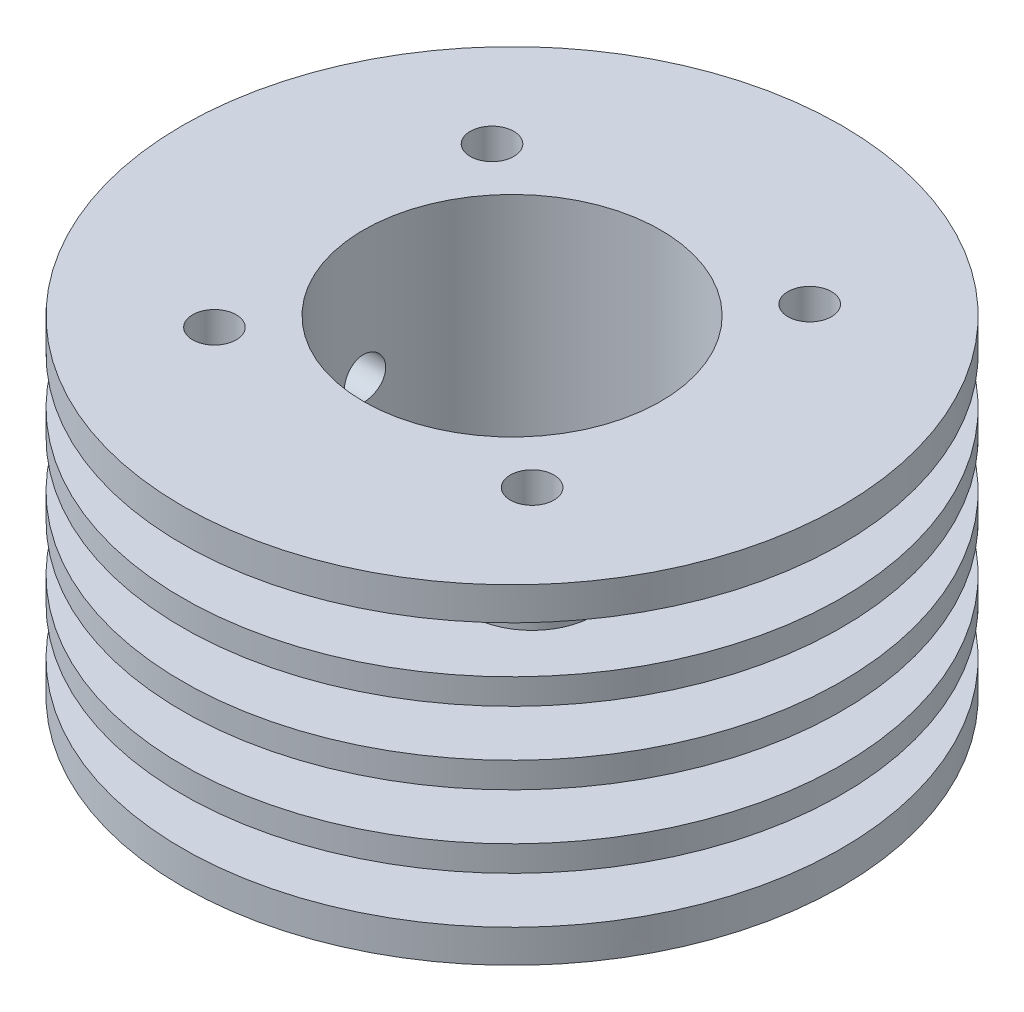
from build123d import *

# Parameters (mm, degrees)
SKETCH1_R                        = 31.75
SKETCH1_R_2                      = 14.3129
BOSS_EXTRUDE1_DEPTH              = 31.75
SKETCH2_W                        = 13.97
SKETCH2_H                        = 4.5
BOSS_EXTRUDE2_START              = -7.675
BOSS_EXTRUDE2_DEPTH              = 4.5
CUT_EXTRUDE2_REACH               = 56.993
CUT_EXTRUDE2_END_RADIUS          = 17.78
SKETCH8_R                        = 2
CUT_EXTRUDE3_REACH               = 56.993
CUT_EXTRUDE3_END_RADIUS          = 17.78
SKETCH9_R                        = 2
SKETCH10_R                       = 1
CUT_EXTRUDE4_DEPTH               = 10.141666667
TAP_DRILL_FOR_M5X0_8_TAP1_REACH  = 74.51
TAP_DRILL_FOR_M5X0_8_TAP1_BORE_R = 2.1


# Read off the part's stored shape, not the designer's step: Boss-Extrude2
with BuildPart() as part:
    # Sketch1 → Boss-Extrude1 (new body)
    with BuildSketch(Plane(origin=(0, 0, 0), x_dir=(1, 0, 0), z_dir=(0, 1, 0))):
        with Locations(Location((0, 0, 0), (0, 0, 270))):
            Circle(SKETCH1_R)
        with Locations(Location((0, 0, 0), (0, 0, 270))):
            Circle(SKETCH1_R_2, mode=Mode.SUBTRACT)
    extrude(amount=BOSS_EXTRUDE1_DEPTH)

    # Sketch2 → Cut-Revolve2 (revolve, cut)
    with BuildSketch(Plane.XY, mode=Mode.PRIVATE) as cut_revolve2_sk:
        with Locations((24.765, 26.325)):
            Rectangle(SKETCH2_W, SKETCH2_H)
        with Locations((24.765, 12.391666667)):
            Rectangle(SKETCH2_W, SKETCH2_H)
        with Locations((24.765, 5.425)):
            Rectangle(SKETCH2_W, SKETCH2_H)
        with Locations((24.765, 19.358333333)):
            Rectangle(SKETCH2_W, SKETCH2_H)
    revolve(cut_revolve2_sk.sketch.rotate(Axis((0, 0, 0), (0, 1, 0)), 90), axis=Axis((0, 0, 0), (0, 1, 0)), mode=Mode.SUBTRACT)

    # Boss-Extrude2 outline → Boss-Extrude2 (add)
    with BuildSketch(Plane(origin=(0, 31.75, 0), x_dir=(1, 0, 0), z_dir=(0, 1, 0)).offset(BOSS_EXTRUDE2_START)):
        with BuildLine():
            ThreePointArc((-10.269067687, -20.446529483), (-6.799835435, -18.70202978), (-3.105226449, -17.506740665))
            ThreePointArc((-3.105226449, -17.506740665), (-11.698828781, -13.38901808), (-16.932025536, -5.425395031))
            ThreePointArc((-16.932025536, -5.425395031), (-17.620944734, -9.246944713), (-18.884341927, -12.918821503))
            ThreePointArc((-18.884341927, -12.918821503), (-17.322622903, -19.825310342), (-10.269067687, -20.446529483))
        make_face()
        with BuildLine():
            ThreePointArc((17.506740665, -3.105226449), (13.38901808, -11.698828781), (5.425395031, -16.932025536))
            ThreePointArc((5.425395031, -16.932025536), (9.246944713, -17.620944734), (12.918821503, -18.884341927))
            ThreePointArc((12.918821503, -18.884341927), (19.825310342, -17.322622903), (20.446529483, -10.269067687))
            ThreePointArc((20.446529483, -10.269067687), (18.70202978, -6.799835435), (17.506740665, -3.105226449))
        make_face()
        with BuildLine():
            ThreePointArc((-20.446529483, 10.269067687), (-18.70202978, 6.799835435), (-17.506740665, 3.105226449))
            ThreePointArc((-17.506740665, 3.105226449), (-13.38901808, 11.698828781), (-5.425395031, 16.932025536))
            ThreePointArc((-5.425395031, 16.932025536), (-9.246944713, 17.620944734), (-12.918821503, 18.884341927))
            ThreePointArc((-12.918821503, 18.884341927), (-19.825310342, 17.322622903), (-20.446529483, 10.269067687))
        make_face()
        with BuildLine():
            ThreePointArc((10.269067687, 20.446529483), (6.799835435, 18.70202978), (3.105226449, 17.506740665))
            ThreePointArc((3.105226449, 17.506740665), (11.698828781, 13.38901808), (16.932025536, 5.425395031))
            ThreePointArc((16.932025536, 5.425395031), (17.620944734, 9.246944713), (18.884341927, 12.918821503))
            ThreePointArc((18.884341927, 12.918821503), (17.322622903, 19.825310342), (10.269067687, 20.446529483))
        make_face()
    extrude(amount=BOSS_EXTRUDE2_DEPTH)

    # Cut-Extrude2: up to this cylinder (the profile starts inside it)
    cut_extrude2_end = Plane(origin=(0, 19.358333, 0), z_dir=(0, -1, 0)) * Cylinder(CUT_EXTRUDE2_END_RADIUS, 150.546, mode=Mode.PRIVATE)
    # Sketch8 → Cut-Extrude2 (cut, up to the surface)
    with BuildSketch(Plane.XY, mode=Mode.PRIVATE) as cut_extrude2_sk1:
        with Locations(Location((0, 19.358333333, 0), (0, 0, 180))):
            Circle(SKETCH8_R)
    cut_extrude2_tool1 = extrude(cut_extrude2_sk1.sketch, amount=CUT_EXTRUDE2_REACH, mode=Mode.PRIVATE) & cut_extrude2_end
    add(cut_extrude2_tool1.solids().sort_by_distance((0, 19.358333, 0))[0], mode=Mode.SUBTRACT)

    # Cut-Extrude3: up to this cylinder (the profile starts inside it)
    cut_extrude3_end = Plane(origin=(0, 19.358333, 0), z_dir=(0, -1, 0)) * Cylinder(CUT_EXTRUDE3_END_RADIUS, 150.546, mode=Mode.PRIVATE)
    # Sketch9 → Cut-Extrude3 (cut, up to the surface)
    with BuildSketch(Plane(origin=(0, 0, 0), x_dir=(0, 0, -1), z_dir=(1, 0, 0)), mode=Mode.PRIVATE) as cut_extrude3_sk1:
        with Locations((0, 19.358333333)):
            Circle(SKETCH9_R)
    cut_extrude3_tool1 = extrude(cut_extrude3_sk1.sketch, amount=-CUT_EXTRUDE3_REACH, mode=Mode.PRIVATE) & cut_extrude3_end
    add(cut_extrude3_tool1.solids().sort_by_distance((0, 19.358333, 0))[0], mode=Mode.SUBTRACT)

    # Sketch10 → Cut-Extrude4 (cut)
    with BuildSketch(Plane(origin=(0, 31.75, 0), x_dir=(1, 0, 0), z_dir=(0, 1, 0))):
        with Locations(Location((15.301734948, -13.370090036, 0), (0, 0, 270))):
            Circle(SKETCH10_R)
        with Locations(Location((13.370090036, 15.301734948, 0), (0, 0, 270))):
            Circle(SKETCH10_R)
        with Locations(Location((-15.301734948, 13.370090036, 0), (0, 0, 270))):
            Circle(SKETCH10_R)
        with Locations(Location((-13.370090036, -15.301734948, 0), (0, 0, 270))):
            Circle(SKETCH10_R)
    extrude(amount=-CUT_EXTRUDE4_DEPTH, mode=Mode.SUBTRACT)

    # Tap Drill for M5x0.8 Tap1 bore (on position points) → Tap Drill for M5x0.8 Tap1 (cut, up to next)
    with BuildSketch(Plane(origin=(15.301734948, 31.75, 13.370090036), x_dir=(0, 0, 1), z_dir=(0, 1, 0)), mode=Mode.PRIVATE) as tap_drill_for_m5x0_8_tap1_sk1:
        Circle(TAP_DRILL_FOR_M5X0_8_TAP1_BORE_R)
    tap_drill_for_m5x0_8_tap1_tool1 = extrude(tap_drill_for_m5x0_8_tap1_sk1.sketch, amount=-TAP_DRILL_FOR_M5X0_8_TAP1_REACH, mode=Mode.PRIVATE) & part.part
    # Tap Drill for M5x0.8 Tap1 bore (on position points) → Tap Drill for M5x0.8 Tap1 (cut, up to next)
    with BuildSketch(Plane(origin=(15.301734948, 31.75, 13.370090036), x_dir=(0, 0, 1), z_dir=(0, 1, 0)), mode=Mode.PRIVATE) as tap_drill_for_m5x0_8_tap1_sk2:
        with Locations((1.931644912, -28.671824984)):
            Circle(TAP_DRILL_FOR_M5X0_8_TAP1_BORE_R)
    tap_drill_for_m5x0_8_tap1_tool2 = extrude(tap_drill_for_m5x0_8_tap1_sk2.sketch, amount=-TAP_DRILL_FOR_M5X0_8_TAP1_REACH, mode=Mode.PRIVATE) & part.part
    # Tap Drill for M5x0.8 Tap1 bore (on position points) → Tap Drill for M5x0.8 Tap1 (cut, up to next)
    with BuildSketch(Plane(origin=(15.301734948, 31.75, 13.370090036), x_dir=(0, 0, 1), z_dir=(0, 1, 0)), mode=Mode.PRIVATE) as tap_drill_for_m5x0_8_tap1_sk3:
        with Locations((-26.740180072, -30.603469896)):
            Circle(TAP_DRILL_FOR_M5X0_8_TAP1_BORE_R)
    tap_drill_for_m5x0_8_tap1_tool3 = extrude(tap_drill_for_m5x0_8_tap1_sk3.sketch, amount=-TAP_DRILL_FOR_M5X0_8_TAP1_REACH, mode=Mode.PRIVATE) & part.part
    # Tap Drill for M5x0.8 Tap1 bore (on position points) → Tap Drill for M5x0.8 Tap1 (cut, up to next)
    with BuildSketch(Plane(origin=(15.301734948, 31.75, 13.370090036), x_dir=(0, 0, 1), z_dir=(0, 1, 0)), mode=Mode.PRIVATE) as tap_drill_for_m5x0_8_tap1_sk4:
        with Locations((-28.671824984, -1.931644912)):
            Circle(TAP_DRILL_FOR_M5X0_8_TAP1_BORE_R)
    tap_drill_for_m5x0_8_tap1_tool4 = extrude(tap_drill_for_m5x0_8_tap1_sk4.sketch, amount=-TAP_DRILL_FOR_M5X0_8_TAP1_REACH, mode=Mode.PRIVATE) & part.part
    add(tap_drill_for_m5x0_8_tap1_tool1.solids().sort_by_distance((15.301735, 31.75, 13.37009))[0], mode=Mode.SUBTRACT)
    add(tap_drill_for_m5x0_8_tap1_tool2.solids().sort_by_distance((-13.37009, 31.75, 15.301735))[0], mode=Mode.SUBTRACT)
    add(tap_drill_for_m5x0_8_tap1_tool3.solids().sort_by_distance((-15.301735, 31.75, -13.37009))[0], mode=Mode.SUBTRACT)
    add(tap_drill_for_m5x0_8_tap1_tool4.solids().sort_by_distance((13.37009, 31.75, -15.301735))[0], mode=Mode.SUBTRACT)


solid = part.part
